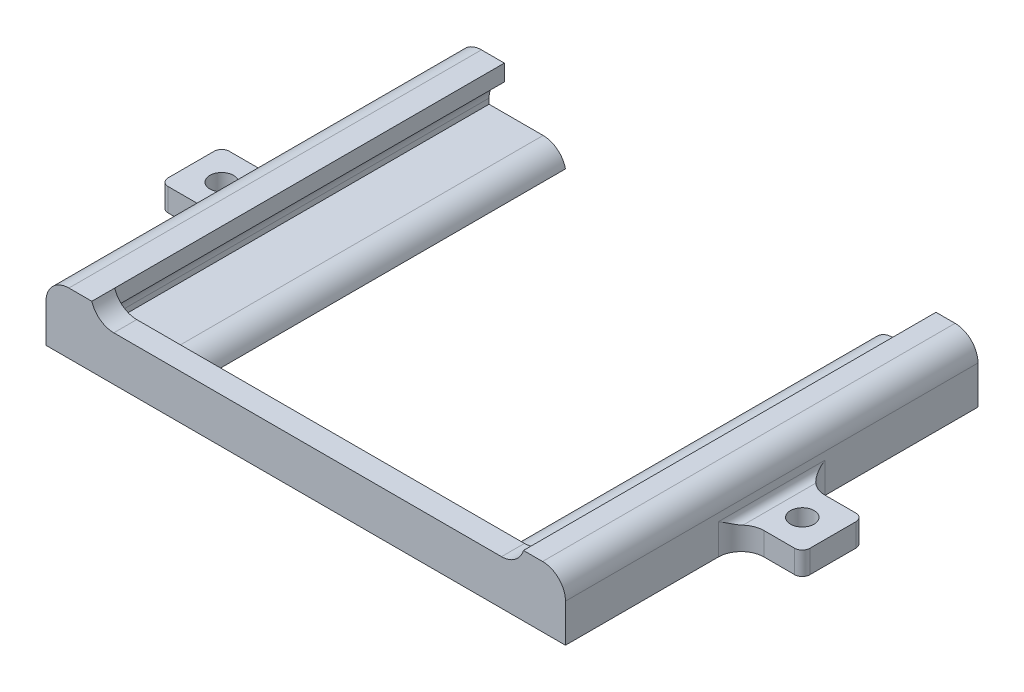
from build123d import *

# Parameters (mm, degrees)
SKETCH1_W           = 68
SKETCH1_H           = 54
BOSS_EXTRUDE1_DEPTH = 8
CUT_EXTRUDE1_DEPTH  = 51
SKETCH2_3_W         = 28.5
SKETCH2_3_H         = 2.140954579
SKETCH2_3_W_2       = 28
CUT_EXTRUDE2_DEPTH  = 65.311740763
FILLET1_R           = 3
FILLET2_R           = 3
SKETCH3_W           = 40
SKETCH3_H           = 2.334194627
CUT_EXTRUDE3_DEPTH  = 51
FILLET3_R           = 3
FILLET4_R           = 3
FILLET5_R           = 3
SKETCH1_3_W         = 8
SKETCH1_3_H         = 8
SKETCH1_3_R         = 1.55
BOSS_EXTRUDE2_DEPTH = 3
FILLET6_R           = 3
FILLET7_R           = 1
FILLET8_R           = 1
FILLET9_R           = 1


with BuildPart() as part:
    # Sketch1 → Boss-Extrude1 (new body)
    with BuildSketch(Plane(origin=(0, 0, 0), x_dir=(1, 0, 0), z_dir=(0, 1, 0))):
        Rectangle(SKETCH1_W, SKETCH1_H)
    extrude(amount=BOSS_EXTRUDE1_DEPTH)

    # Sketch2 → Cut-Extrude1 (cut)
    with BuildSketch(Plane(origin=(0, 0, -27), x_dir=(-1, 0, 0), z_dir=(0, 0, -1))):
        Polygon((-30.5, 2.334194627), (0, 2.334194627), (0, 5.859045421), (-28.5, 5.859045421), (-30.5, 5.859045421), align=None)
        Polygon((0, 5.859045421), (0, 2.334194627), (30, 2.334194627), (30, 5.859045421), (28, 5.859045421), align=None)
    extrude(amount=-CUT_EXTRUDE1_DEPTH, mode=Mode.SUBTRACT)

    # Sketch2<3> → Cut-Extrude2 (cut, through all)
    with BuildSketch(Plane(origin=(0, 0, -27), x_dir=(-1, 0, 0), z_dir=(0, 0, -1))):
        with Locations((-14.25, 6.929522711)):
            Rectangle(SKETCH2_3_W, SKETCH2_3_H)
        with Locations((14, 6.929522711)):
            Rectangle(SKETCH2_3_W_2, SKETCH2_3_H)
    extrude(amount=-CUT_EXTRUDE2_DEPTH, mode=Mode.SUBTRACT)

    # Fillet1
    # the kernel refuses this fillet: 3 mm, written as the material it adds along each edge
    with BuildSketch(Plane(origin=(30.5, 5.859045421, -27), x_dir=(0, -1, 0), z_dir=(0, 0, 1))) as fillet1_piece_1:
        with BuildLine():
            CenterArc((2.828427125, -3), FILLET1_R, 90, 70.528779366)
            Line((0, -2), (-0.056568542, -1.98))
            ThreePointArc((-0.056568542, -1.98), (-0.06, -1), (-0.06, 0))
            Line((-0.06, 0), (0, 0.06))
            Line((0, 0.06), (2.828427125, 0.06))
            Line((2.828427125, 0.06), (2.828427125, 0))
        make_face()
    extrude(amount=51)
    with BuildSketch(Plane(origin=(-30, 5.859045421, -27), x_dir=(1, 0, 0), z_dir=(0, 0, 1))) as fillet1_piece_2:
        with BuildLine():
            CenterArc((3, -2.828427125), FILLET1_R, 109.471220634, 70.528779366)
            Line((0, -2.828427125), (-0.06, -2.828427125))
            Line((-0.06, -2.828427125), (-0.06, 0))
            Line((-0.06, 0), (0, 0.06))
            ThreePointArc((0, 0.06), (1, 0.06), (1.98, 0.056568542))
            Line((1.98, 0.056568542), (2, 0))
        make_face()
    extrude(amount=51)

    # Fillet2
    fillet2_edges = [part.edges().sort_by_distance(p)[0] for p in [
        (34, 8, 0),
        (-34, 8, 0),
    ]]
    fillet(fillet2_edges, radius=FILLET2_R)

    # Sketch3 → Cut-Extrude3 (cut)
    with BuildSketch(Plane(origin=(0, 0, -27), x_dir=(-1, 0, 0), z_dir=(0, 0, -1))):
        with Locations((0, 1.167097314)):
            Rectangle(SKETCH3_W, SKETCH3_H)
    extrude(amount=-CUT_EXTRUDE3_DEPTH, mode=Mode.SUBTRACT)

    # Fillet3
    fillet3_edges = [part.edges().sort_by_distance(p)[0] for p in [
        (20, 1.167097313, 24),
        (-20, 1.167097313, 24),
    ]]
    fillet(fillet3_edges, radius=FILLET3_R)

    # Fillet4
    # the kernel refuses this fillet: 3 mm, written as the material it takes off along each edge
    with BuildSketch(Plane(origin=(-17, 2.334194627, 21), x_dir=(0.6464786745536378, 0, -0.762932056835582), z_dir=(-0.762932056835582, 0, -0.6464786745536378))) as fillet4_piece_1_section:
        with BuildLine():
            CenterArc((5.925184303, 3), FILLET4_R, 192.822717627, 77.177282373)
            Line((3, 2.334194627), (3, 0))
            Line((3, 0), (5.925184303, 0))
        make_face()
    fillet4_piece_1 = revolve(axis=Axis((-17, 2.334194627, 21), (0, -1, 0)), revolution_arc=229.72336785, mode=Mode.PRIVATE)
    fillet4_piece_1 = split(fillet4_piece_1, bisect_by=Plane(origin=(-17, 2.334194627, 24), z_dir=(0, 0, -1)), keep=Keep.TOP, mode=Mode.PRIVATE)
    add(fillet4_piece_1, mode=Mode.SUBTRACT)
    with BuildSketch(Plane(origin=(17, 2.334194627, 21), x_dir=(1, 0, 0), z_dir=(0, 0, -1))) as fillet4_piece_2_section:
        with BuildLine():
            CenterArc((5.925184303, 3), FILLET4_R, 192.822717627, 77.177282373)
            Line((3, 2.334194627), (3, 0))
            Line((3, 0), (5.925184303, 0))
        make_face()
    fillet4_piece_2 = revolve(axis=Axis((17, 2.334194627, 21), (0, -1, 0)), revolution_arc=229.72336785, mode=Mode.PRIVATE)
    fillet4_piece_2 = split(fillet4_piece_2, bisect_by=Plane(origin=(17, 2.334194627, 24), z_dir=(0, 0, -1)), keep=Keep.TOP, mode=Mode.PRIVATE)
    add(fillet4_piece_2, mode=Mode.SUBTRACT)
    with BuildSketch(Plane(origin=(-20, 2.334194627, -34.312960757), x_dir=(-1, 0, 0), z_dir=(0, 0, 1))) as fillet4_piece_3:
        with BuildLine():
            CenterArc((2.925184303, 3), FILLET4_R, 192.822717627, 77.177282373)
            Line((0, 2.334194627), (0, 0))
            Line((0, 0), (2.925184303, 0))
        make_face()
    extrude(amount=55.312960757, mode=Mode.SUBTRACT)
    with BuildSketch(Plane(origin=(20, 2.334194627, -34.312960757), x_dir=(1, 0, 0), z_dir=(0, 0, 1))) as fillet4_piece_4:
        with BuildLine():
            CenterArc((2.925184303, -3), FILLET4_R, 90, 77.177282373)
            Line((0, -2.334194627), (0, 0))
            Line((0, 0), (2.925184303, 0))
        make_face()
    extrude(amount=55.312960757, mode=Mode.SUBTRACT)

    # Fillet5
    # the kernel refuses this fillet: 3 mm, written as the material it adds along each edge
    with BuildSketch(Plane(origin=(28.5, 5.859045421, 24), x_dir=(-1, 0, 0), z_dir=(0, 0, 1))) as fillet5_piece_1:
        with BuildLine():
            CenterArc((2.874376622, -3), FILLET5_R, 90, 73.360529794)
            Line((0, -2.140954579), (-0.057487532, -2.123773671))
            ThreePointArc((-0.057487532, -2.123773671), (-0.06, -1.07047729), (-0.06, 0))
            Line((-0.06, 0), (0, 0.06))
            Line((0, 0.06), (2.874376622, 0.06))
            Line((2.874376622, 0.06), (2.874376622, 0))
        make_face()
    extrude(amount=3)
    with BuildSketch(Plane(origin=(-28, 5.859045421, 24), x_dir=(1, 0, 0), z_dir=(0, 0, 1))) as fillet5_piece_2:
        with BuildLine():
            CenterArc((2.874376622, 3), FILLET5_R, 196.639470206, 73.360529794)
            Line((0, 2.140954579), (-0.057487532, 2.123773671))
            ThreePointArc((-0.057487532, 2.123773671), (-0.06, 1.07047729), (-0.06, 0))
            Line((-0.06, 0), (0, -0.06))
            Line((0, -0.06), (2.874376622, -0.06))
            Line((2.874376622, -0.06), (2.874376622, 0))
        make_face()
    extrude(amount=3)

    # Sketch1<3> → Boss-Extrude2 (add)
    # profile 1 of 2: a face of its own
    with BuildSketch(Plane(origin=(0, 0, 0), x_dir=(1, 0, 0), z_dir=(0, 1, 0))):
        with Locations((-38, 0)):
            Rectangle(SKETCH1_3_W, SKETCH1_3_H)
        with Locations(Location((-38, 0, 0), (0, 0, 270))):
            Circle(SKETCH1_3_R, mode=Mode.SUBTRACT)
    # profile 2 of 2: a face of its own
    with BuildSketch(Plane(origin=(0, 0, 0), x_dir=(1, 0, 0), z_dir=(0, 1, 0))):
        with Locations((38, 0)):
            Rectangle(SKETCH1_3_W, SKETCH1_3_H)
        with Locations(Location((38, 0, 0), (0, 0, 270))):
            Circle(SKETCH1_3_R, mode=Mode.SUBTRACT)
    extrude(amount=BOSS_EXTRUDE2_DEPTH)

    # Fillet6
    fillet6_edges = [part.edges().sort_by_distance(p)[0] for p in [
        (-34, 1.5, -4),
        (-34, 1.5, 4),
        (34, 1.5, -4),
        (34, 1.5, 4),
    ]]
    fillet(fillet6_edges, radius=FILLET6_R)

    # Fillet7
    fillet7_edges = [part.edges().sort_by_distance(p)[0] for p in [
        (34, 3, 0),
    ]]
    fillet(fillet7_edges, radius=FILLET7_R)

    # Fillet8
    fillet8_edges = [part.edges().sort_by_distance(p)[0] for p in [
        (-34, 3, 0),
    ]]
    fillet(fillet8_edges, radius=FILLET8_R)

    # Fillet9
    fillet9_edges = [part.edges().sort_by_distance(p)[0] for p in [
        (-42, 1.5, -4),
        (-42, 1.5, 4),
        (42, 1.5, -4),
        (42, 1.5, 4),
    ]]
    fillet(fillet9_edges, radius=FILLET9_R)


solid = part.part
